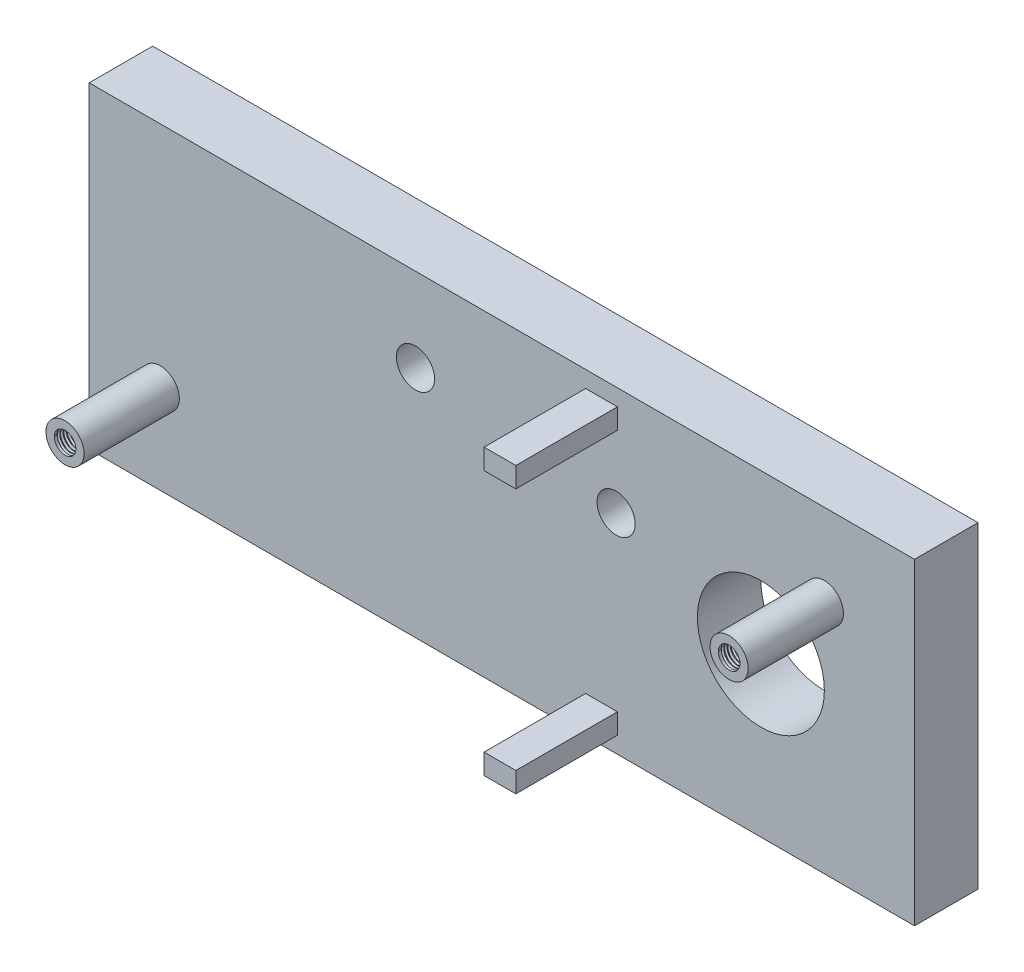
from build123d import *
from build123d.topology import SkipClean

# Parameters (mm, degrees)
SKETCH1_W           = 65
SKETCH1_H           = 25
BOSS_EXTRUDE1_DEPTH = 2.5
SKETCH4_R           = 5
CUT_EXTRUDE1_DEPTH  = 5
SKETCH5_R           = 1.502135948
SKETCH5_R_2         = 1.502450829
BOSS_EXTRUDE2_DEPTH = 7.5
SKETCH6_R           = 1.502450829
SKETCH6_R_2         = 1.502135948
CUT_EXTRUDE2_DEPTH  = 7.5
SKETCH8_R           = 0.85
CUT_EXTRUDE3_DEPTH  = 5
THREAD1_PITCH       = 0.25
THREAD2_PITCH       = 0.25
SKETCH14_W          = 2.5
SKETCH14_H          = 1.6
BOSS_EXTRUDE3_DEPTH = 8


with BuildPart() as part:
    # Sketch1 → Boss-Extrude1 (new, symmetric)
    with BuildSketch(Plane.XY):
        Rectangle(SKETCH1_W, SKETCH1_H)
    extrude(amount=BOSS_EXTRUDE1_DEPTH, both=True)

    # Sketch4 → Cut-Extrude1 (cut)
    with BuildSketch(Plane.XY.offset(2.5)):
        with Locations((20.4, 0)):
            Circle(SKETCH4_R)
    extrude(amount=-CUT_EXTRUDE1_DEPTH, mode=Mode.SUBTRACT)

    # Sketch5 → Boss-Extrude2 (add)
    with BuildSketch(Plane.XY.offset(2.5)):
        with Locations((25.4, 6)):
            Circle(SKETCH5_R)
        with Locations((-26.9, -5.5)):
            Circle(SKETCH5_R_2)
    extrude(amount=BOSS_EXTRUDE2_DEPTH)

    # Sketch6 → Cut-Extrude2 (cut)
    with BuildSketch(Plane.XY.offset(2.5)):
        with Locations((-6.8, 5.9)):
            Circle(SKETCH6_R)
        with Locations((9, 3.9)):
            Circle(SKETCH6_R_2)
    extrude(amount=-CUT_EXTRUDE2_DEPTH, mode=Mode.SUBTRACT)

    # Sketch8 → Cut-Extrude3 (cut)
    with BuildSketch(Plane.XY.offset(10)):
        with Locations((-26.9, -5.5)):
            Circle(SKETCH8_R)
        with Locations((25.4, 6)):
            Circle(SKETCH8_R)
    extrude(amount=-CUT_EXTRUDE3_DEPTH, mode=Mode.SUBTRACT)

    # Thread1: the profile of Thread Profile1 profile screwed along a right-hand helix of 20 turns, 6 arcs to a turn; built about Z, then put on its axis
    with SkipClean():  # the faces are left unmerged after this step: merging them gives an invalid solid
        thread1_z = Axis((0, 0, 0), (0, 0, 1))
        thread1_corners = [(0.8497, 0, -0.000173205), (0.985316469, 0, 0.078125), (0.985316469, 0, 0.109375), (0.8497, 0, 0.187673204)]
        with BuildLine(mode=Mode.PRIVATE) as thread1_profile:
            Line(thread1_corners[0], thread1_corners[1])
            Line(thread1_corners[1], thread1_corners[2])
            Line(thread1_corners[2], thread1_corners[3])
            Line(thread1_corners[3], thread1_corners[0])
        thread1_cap = Face(thread1_profile.wire())
        thread1_turn_angles = [0, 30, 60, 90, 120, 150, 180, 210, 240, 270, 300, 330, 360]
        thread1_turn_weights = [1, 0.8660254037844387, 1, 0.8660254037844387, 1, 0.8660254037844387, 1, 0.8660254037844387, 1, 0.8660254037844387, 1, 0.8660254037844387, 1]
        thread1_turn_rails = [Edge.make_bspline([Vector(p[0], p[1], 0).rotate(thread1_z, thread1_turn_angles[k]) / thread1_turn_weights[k] + Vector(0, 0, p[2] + THREAD1_PITCH * thread1_turn_angles[k] / 360) for k in range(13)], [0, 0, 0, 1, 1, 2, 2, 3, 3, 4, 4, 5, 5, 6, 6, 6], 2, thread1_turn_weights) for p in thread1_corners]
        thread1_turn_sides = [Face.make_surface_from_curves(thread1_turn_rails[p[0]], thread1_turn_rails[p[1]]) for p in [(0, 1), (1, 2), (2, 3), (3, 0)]]
        thread1 = Plane(origin=(-26.9, -5.5, 10), x_dir=(-1, 0, 0), z_dir=(0, 0, -1)) * Solid(Shell([*[p.moved(Location((0, 0, THREAD1_PITCH * i))) for i in range(20) for p in thread1_turn_sides], thread1_cap, thread1_cap.rotate(thread1_z, 7200).moved(Location((0, 0, THREAD1_PITCH * 7200 / 360)))]))
        add(thread1, mode=Mode.SUBTRACT)

    # Thread2: the profile of Thread Profile2 profile screwed along a right-hand helix of 20 turns, 6 arcs to a turn; built about Z, then put on its axis
    with SkipClean():  # the faces are left unmerged after this step: merging them gives an invalid solid
        thread2_z = Axis((0, 0, 0), (0, 0, 1))
        thread2_corners = [(0.8497, 0, -0.000173205), (0.985316469, 0, 0.078125), (0.985316469, 0, 0.109375), (0.8497, 0, 0.187673204)]
        with BuildLine(mode=Mode.PRIVATE) as thread2_profile:
            Line(thread2_corners[0], thread2_corners[1])
            Line(thread2_corners[1], thread2_corners[2])
            Line(thread2_corners[2], thread2_corners[3])
            Line(thread2_corners[3], thread2_corners[0])
        thread2_cap = Face(thread2_profile.wire())
        thread2_turn_angles = [0, 30, 60, 90, 120, 150, 180, 210, 240, 270, 300, 330, 360]
        thread2_turn_weights = [1, 0.8660254037844387, 1, 0.8660254037844387, 1, 0.8660254037844387, 1, 0.8660254037844387, 1, 0.8660254037844387, 1, 0.8660254037844387, 1]
        thread2_turn_rails = [Edge.make_bspline([Vector(p[0], p[1], 0).rotate(thread2_z, thread2_turn_angles[k]) / thread2_turn_weights[k] + Vector(0, 0, p[2] + THREAD2_PITCH * thread2_turn_angles[k] / 360) for k in range(13)], [0, 0, 0, 1, 1, 2, 2, 3, 3, 4, 4, 5, 5, 6, 6, 6], 2, thread2_turn_weights) for p in thread2_corners]
        thread2_turn_sides = [Face.make_surface_from_curves(thread2_turn_rails[p[0]], thread2_turn_rails[p[1]]) for p in [(0, 1), (1, 2), (2, 3), (3, 0)]]
        thread2 = Plane(origin=(25.4, 6, 10), x_dir=(-1, 0, 0), z_dir=(0, 0, -1)) * Solid(Shell([*[p.moved(Location((0, 0, THREAD2_PITCH * i))) for i in range(20) for p in thread2_turn_sides], thread2_cap, thread2_cap.rotate(thread2_z, 7200).moved(Location((0, 0, THREAD2_PITCH * 7200 / 360)))]))
        add(thread2, mode=Mode.SUBTRACT)

    # Sketch14 → Boss-Extrude3 (add)
    with SkipClean():  # the faces are left unmerged after this step: merging them gives an invalid solid
        with BuildSketch(Plane.XY.offset(2.5)):
            with Locations((7.85, 10.4)):
                Rectangle(SKETCH14_W, SKETCH14_H)
            with Locations((7.85, -10.4)):
                Rectangle(SKETCH14_W, SKETCH14_H)
        extrude(amount=BOSS_EXTRUDE3_DEPTH)


solid = part.part
